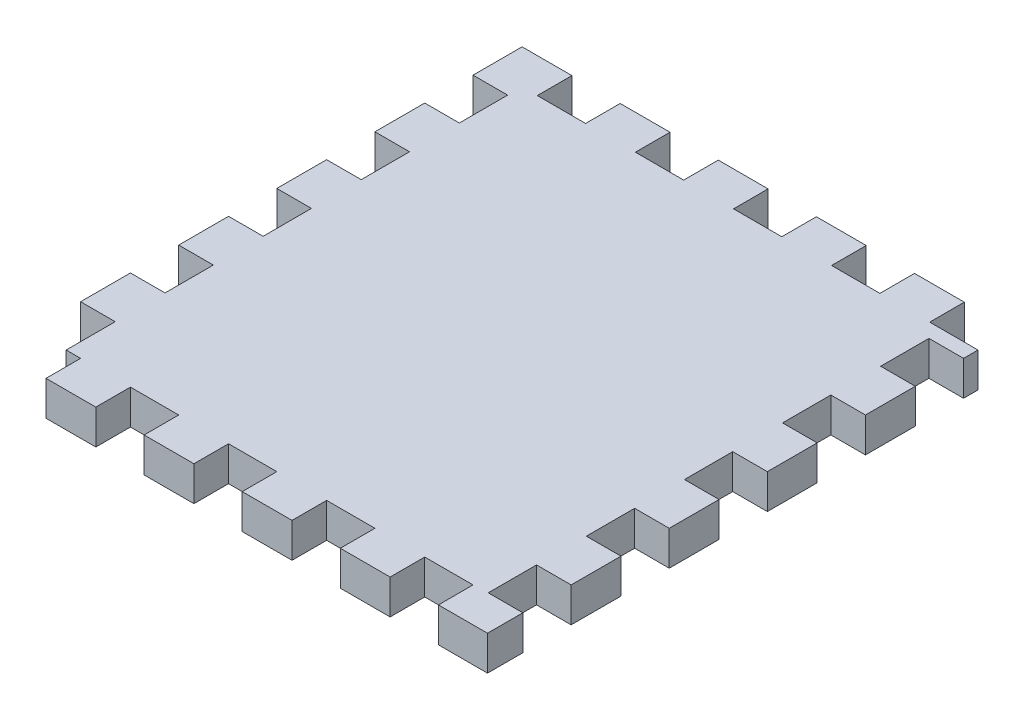
from build123d import *

# Parameters (mm, degrees)
SKETCH2_W           = 45
SKETCH2_H           = 45
BOSS_EXTRUDE1_DEPTH = 1.5875
SKETCH4_W           = 4.57
SKETCH4_H           = 3.175
BOSS_EXTRUDE2_DEPTH = 3.175
SKETCH5_W           = 4.43
SKETCH5_H           = 3.175
CUT_EXTRUDE2_DEPTH  = 3.175
LPATTERN1_COUNT     = 5
LPATTERN1_PITCH     = 9
LPATTERN2_COUNT     = 5
LPATTERN2_PITCH     = 9
SKETCH10_W          = 0.07
SKETCH10_H          = 3.175
CUT_EXTRUDE5_DEPTH  = 3.175
SKETCH9_W           = 4.43
SKETCH9_H           = 3.175
CUT_EXTRUDE4_DEPTH  = 3.175
SKETCH11_W          = 0.07
SKETCH11_H          = 3.175
CUT_EXTRUDE6_DEPTH  = 3.175
LPATTERN4_COUNT     = 5
LPATTERN4_PITCH     = 9
SKETCH14_W          = 4.43
SKETCH14_H          = 3.175
CUT_EXTRUDE7_DEPTH  = 3.175
LPATTERN5_COUNT     = 5
LPATTERN5_PITCH     = 9


with BuildPart() as part:
    # Sketch2 → Boss-Extrude1 (new, symmetric)
    with BuildSketch(Plane(origin=(0, 0, 0), x_dir=(1, 0, 0), z_dir=(0, 1, 0))):
        Rectangle(SKETCH2_W, SKETCH2_H)
    extrude(amount=BOSS_EXTRUDE1_DEPTH, both=True)

    # Sketch4 → Boss-Extrude2 (add)
    with BuildSketch(Plane(origin=(0, 0, -22.5), x_dir=(-1, 0, 0), z_dir=(0, 0, -1))):
        with Locations((20.215, 0)):
            Rectangle(SKETCH4_W, SKETCH4_H)
    boss_extrude2 = extrude(amount=BOSS_EXTRUDE2_DEPTH)

    # Sketch5 → Cut-Extrude2 (cut)
    with BuildSketch(Plane.XY.offset(22.5)):
        with Locations((-20.215, 0)):
            Rectangle(SKETCH5_W, SKETCH5_H)
    cut_extrude2 = extrude(amount=-CUT_EXTRUDE2_DEPTH, mode=Mode.SUBTRACT)

    # LPattern1: Cut-Extrude2 ×5
    with Locations(*[(i * LPATTERN1_PITCH, 0, 0) for i in range(1, LPATTERN1_COUNT)]):
        add(cut_extrude2, mode=Mode.SUBTRACT)

    # LPattern2: Boss-Extrude2 ×5
    with Locations(*[(i * LPATTERN2_PITCH, 0, 0) for i in range(1, LPATTERN2_COUNT)]):
        add(boss_extrude2)

    # Sketch10 → Cut-Extrude5 (cut)
    with BuildSketch(Plane.XY.offset(22.5)):
        with Locations((-22.465, 0)):
            Rectangle(SKETCH10_W, SKETCH10_H)
    extrude(amount=-CUT_EXTRUDE5_DEPTH, mode=Mode.SUBTRACT)

    # Sketch9 → Cut-Extrude4 (cut)
    with BuildSketch(Plane.ZY.offset(22.5)):
        with Locations((17.04, 0)):
            Rectangle(SKETCH9_W, SKETCH9_H)
    cut_extrude4 = extrude(amount=-CUT_EXTRUDE4_DEPTH, mode=Mode.SUBTRACT)

    # Sketch11 → Cut-Extrude6 (cut)
    with BuildSketch(Plane.ZY.offset(22.5)):
        with Locations((19.29, 0)):
            Rectangle(SKETCH11_W, SKETCH11_H)
    extrude(amount=-CUT_EXTRUDE6_DEPTH, mode=Mode.SUBTRACT)

    # LPattern4: Cut-Extrude4 ×5
    with Locations(*[(0, 0, -i * LPATTERN4_PITCH) for i in range(1, LPATTERN4_COUNT)]):
        add(cut_extrude4, mode=Mode.SUBTRACT)

    # Sketch14 → Cut-Extrude7 (cut)
    with BuildSketch(Plane(origin=(22.5, 0, 0), x_dir=(0, 0, -1), z_dir=(1, 0, 0))):
        with Locations((-17.04, 0)):
            Rectangle(SKETCH14_W, SKETCH14_H)
    cut_extrude7 = extrude(amount=-CUT_EXTRUDE7_DEPTH, mode=Mode.SUBTRACT)

    # LPattern5: Cut-Extrude7 ×5
    with Locations(*[(0, 0, -i * LPATTERN5_PITCH) for i in range(1, LPATTERN5_COUNT)]):
        add(cut_extrude7, mode=Mode.SUBTRACT)


solid = part.part
